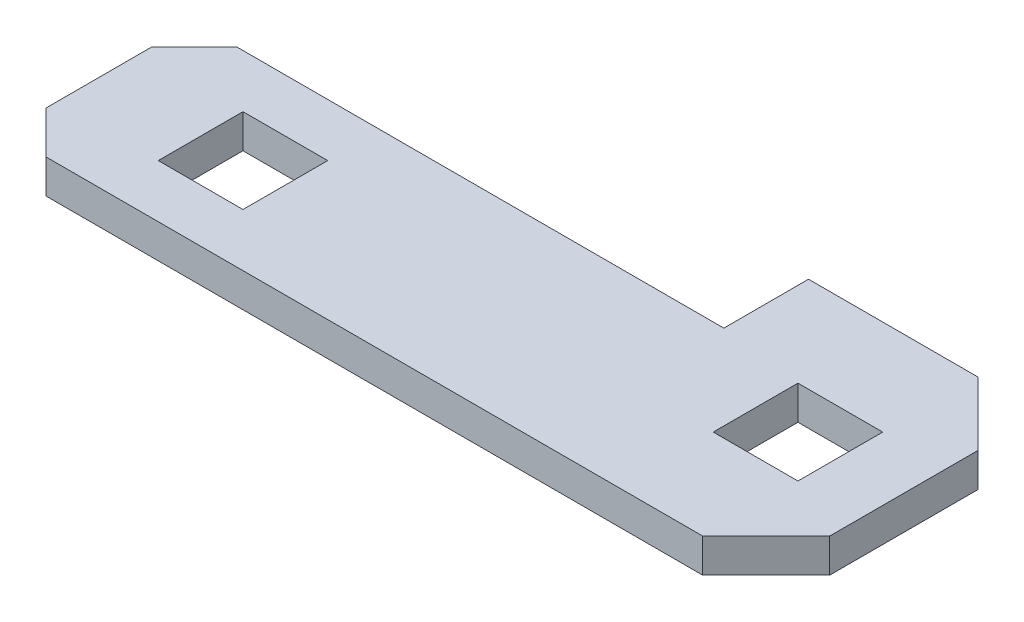
from build123d import *

# Parameters (mm, degrees)
SKETCH_1_W             = 2
SKETCH_1_H             = 2
SM_BASE_FLANGE_1_DEPTH = 0.8
CHAMFER_1_SIZE         = 1
CHAMFER_2_SIZE         = 1.5


# Sheet-metal steps are written as plain solids
with BuildPart() as part:
    # Sketch 1 → Базовая кромка1 (new body)
    with BuildSketch(Plane(origin=(0, 0, 0), x_dir=(1, 0, 0), z_dir=(0, 1, 0))):
        Polygon((0, 0), (0, 4.5), (12.5, 4.5), (12.5, 6.5), (18, 6.5), (18, 0), align=None)
        with Locations((3.4, 2.25)):
            Rectangle(SKETCH_1_W, SKETCH_1_H, mode=Mode.SUBTRACT)
        with Locations((15.5, 3.25)):
            Rectangle(SKETCH_1_W, SKETCH_1_H, mode=Mode.SUBTRACT)
    extrude(amount=-SM_BASE_FLANGE_1_DEPTH)

    # Фаска1
    chamfer_1_edges = [part.edges().sort_by_distance(p)[0] for p in [
        (0, -0.4, 0),
        (0, -0.4, -4.5),
    ]]
    chamfer(chamfer_1_edges, length=CHAMFER_1_SIZE)

    # Фаска2
    chamfer_2_edges = [part.edges().sort_by_distance(p)[0] for p in [
        (18, -0.4, -6.5),
        (18, -0.4, 0),
    ]]
    chamfer(chamfer_2_edges, length=CHAMFER_2_SIZE)


solid = part.part
